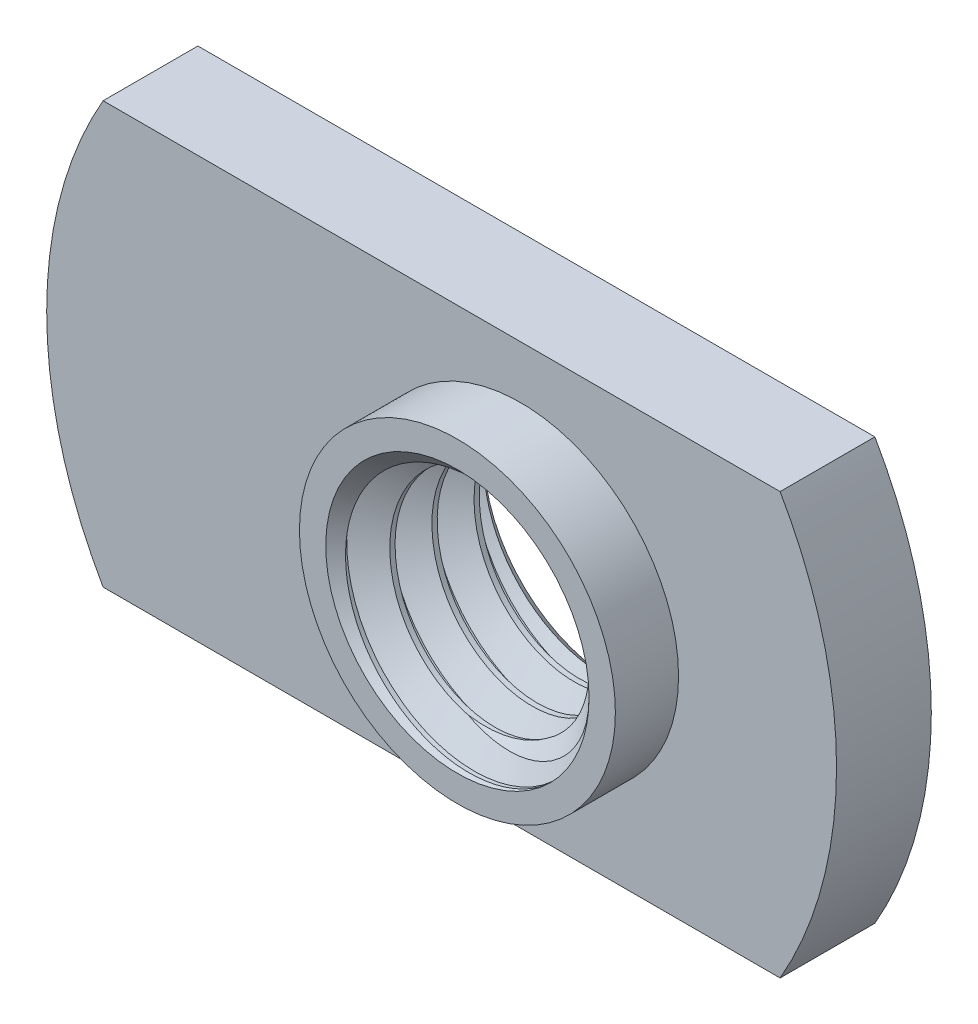
from build123d import *

# Parameters (mm, degrees)
BOSS_EXTRUDE1_DEPTH     = 0.9
SKETCH8_R               = 3
SKETCH8_R_2             = 2.5
BOSS_EXTRUDE2_DEPTH     = 1.2
CUT_EXTRUDE1_DEPTH      = 11.070253224
CUT_EXTRUDE1_DEPTH_BACK = 11.070253224
SKETCH1_R               = 2.5
SWEEP1_PITCH            = 0.8
SPLIT1_START            = -3.0000001
SPLIT1_OUTLINE_W        = 8
SPLIT1_OUTLINE_H        = 2.1
SPLIT1_OUTLINE_H_2      = 1.9
SPLIT1_DEPTH            = 6.0000002


with BuildPart() as part:
    # Sketch7 → Boss-Extrude1 (new, symmetric)
    with BuildSketch(Plane.XY):
        with BuildLine():
            Line((-7.92820323, 4), (4.92820323, 4))
            ThreePointArc((4.92820323, 4), (6, 0), (4.92820323, -4))
            Line((4.92820323, -4), (-7.92820323, -4))
            ThreePointArc((-7.92820323, -4), (-9, 0), (-7.92820323, 4))
        make_face()
    extrude(amount=BOSS_EXTRUDE1_DEPTH, both=True)

    # Sketch8 → Boss-Extrude2 (add)
    with BuildSketch(Plane.XY.offset(0.9)):
        with Locations(Location((0, 0, 0), (0, 0, 180))):
            Circle(SKETCH8_R)
        Circle(SKETCH8_R_2, mode=Mode.SUBTRACT)
    extrude(amount=BOSS_EXTRUDE2_DEPTH)

    # Sketch1 → Cut-Extrude1 (cut, two sides: drawn at the far end of the back side and taken through both)
    with BuildSketch(Plane.XY.offset(-CUT_EXTRUDE1_DEPTH_BACK)):
        Circle(SKETCH1_R)
    extrude(amount=CUT_EXTRUDE1_DEPTH + CUT_EXTRUDE1_DEPTH_BACK, mode=Mode.SUBTRACT)

    # Sweep1: arcs per turn and ends read off the stored shape
    # Sweep1: the profile of Sketch3 screwed along a right-hand helix through 4.75 turns, 8 arcs to a turn; built about Z, then put on its axis
    sweep1_z = Axis((0, 0, 0), (0, 0, 1))
    sweep1_corners = [(2.54330127, 0, 0.025), (2.54330127, 0, -0.725), (1.980384758, 0, -0.4), (1.980384758, 0, -0.3)]
    with BuildLine(mode=Mode.PRIVATE) as sweep1_profile:
        Line(sweep1_corners[0], sweep1_corners[1])
        Line(sweep1_corners[1], sweep1_corners[2])
        Line(sweep1_corners[2], sweep1_corners[3])
        Line(sweep1_corners[3], sweep1_corners[0])
    sweep1_cap = Face(sweep1_profile.wire())
    sweep1_turn_angles = [0, 22.5, 45, 67.5, 90, 112.5, 135, 157.5, 180, 202.5, 225, 247.5, 270, 292.5, 315, 337.5, 360]
    sweep1_turn_weights = [1, 0.9238795325112867, 1, 0.9238795325112867, 1, 0.9238795325112867, 1, 0.9238795325112867, 1, 0.9238795325112867, 1, 0.9238795325112867, 1, 0.9238795325112867, 1, 0.9238795325112867, 1]
    sweep1_turn_rails = [Edge.make_bspline([Vector(p[0], p[1], 0).rotate(sweep1_z, sweep1_turn_angles[k]) / sweep1_turn_weights[k] + Vector(0, 0, p[2] + SWEEP1_PITCH * sweep1_turn_angles[k] / 360) for k in range(17)], [0, 0, 0, 1, 1, 2, 2, 3, 3, 4, 4, 5, 5, 6, 6, 7, 7, 8, 8, 8], 2, sweep1_turn_weights) for p in sweep1_corners]
    sweep1_turn_sides = [Face.make_surface_from_curves(sweep1_turn_rails[p[0]], sweep1_turn_rails[p[1]]) for p in [(0, 1), (1, 2), (2, 3), (3, 0)]]
    sweep1_last_angles = [1440, 1462.5, 1485, 1507.5, 1530, 1552.5, 1575, 1597.5, 1620, 1642.5, 1665, 1687.5, 1710]
    sweep1_last_weights = [1, 0.9238795325112867, 1, 0.9238795325112867, 1, 0.9238795325112867, 1, 0.9238795325112867, 1, 0.9238795325112867, 1, 0.9238795325112776, 1]
    sweep1_last_rails = [Edge.make_bspline([Vector(p[0], p[1], 0).rotate(sweep1_z, sweep1_last_angles[k]) / sweep1_last_weights[k] + Vector(0, 0, p[2] + SWEEP1_PITCH * sweep1_last_angles[k] / 360) for k in range(13)], [0, 0, 0, 1, 1, 2, 2, 3, 3, 4, 4, 5, 5, 6, 6, 6], 2, sweep1_last_weights) for p in sweep1_corners]
    sweep1_last_sides = [Face.make_surface_from_curves(sweep1_last_rails[p[0]], sweep1_last_rails[p[1]]) for p in [(0, 1), (1, 2), (2, 3), (3, 0)]]
    sweep1 = Plane(origin=(0, 0, -0.9), x_dir=(0, 1, 0), z_dir=(0, 0, 1)) * Solid(Shell([*[p.moved(Location((0, 0, SWEEP1_PITCH * i))) for i in range(4) for p in sweep1_turn_sides], *sweep1_last_sides, sweep1_cap, sweep1_cap.rotate(sweep1_z, 1710).moved(Location((0, 0, SWEEP1_PITCH * 1710 / 360)))]))
    add(sweep1)

    # Split1: read off the stored shape, not the designer's step
    # Split1 outline → Split1 (cut)
    with BuildSketch(Plane(origin=(0, 0, 0), x_dir=(1, 0, 0), z_dir=(0, 1, 0)).offset(SPLIT1_START)):
        with Locations((0, 1.95)):
            Rectangle(SPLIT1_OUTLINE_W, SPLIT1_OUTLINE_H)
        with Locations((0, -3.05)):
            Rectangle(SPLIT1_OUTLINE_W, SPLIT1_OUTLINE_H_2)
    extrude(amount=SPLIT1_DEPTH, mode=Mode.SUBTRACT)

    # Cut-Extrude2 cone 1 section (through the dimple's axis) → Cut-Extrude2 (revolve, cut)
    with BuildSketch(Plane(origin=(0, 0, -0.9), x_dir=(0, 1, 0), z_dir=(1, 0, 0))):
        Polygon((0, 0), (2.5, 0), (0, 2.5), align=None)
    revolve(axis=Axis((0, 0, -0.9), (0, 0, 1)), mode=Mode.SUBTRACT)

    # Cut-Extrude3 cone 1 section (through the dimple's axis) → Cut-Extrude3 (revolve, cut)
    with BuildSketch(Plane(origin=(0, 0, 2.1), x_dir=(0, -1, 0), z_dir=(1, 0, 0))):
        Polygon((0, 0), (2.5, 0), (0, 2.5), align=None)
    revolve(axis=Axis((0, 0, 2.1), (0, 0, -1)), mode=Mode.SUBTRACT)


solid = part.part
